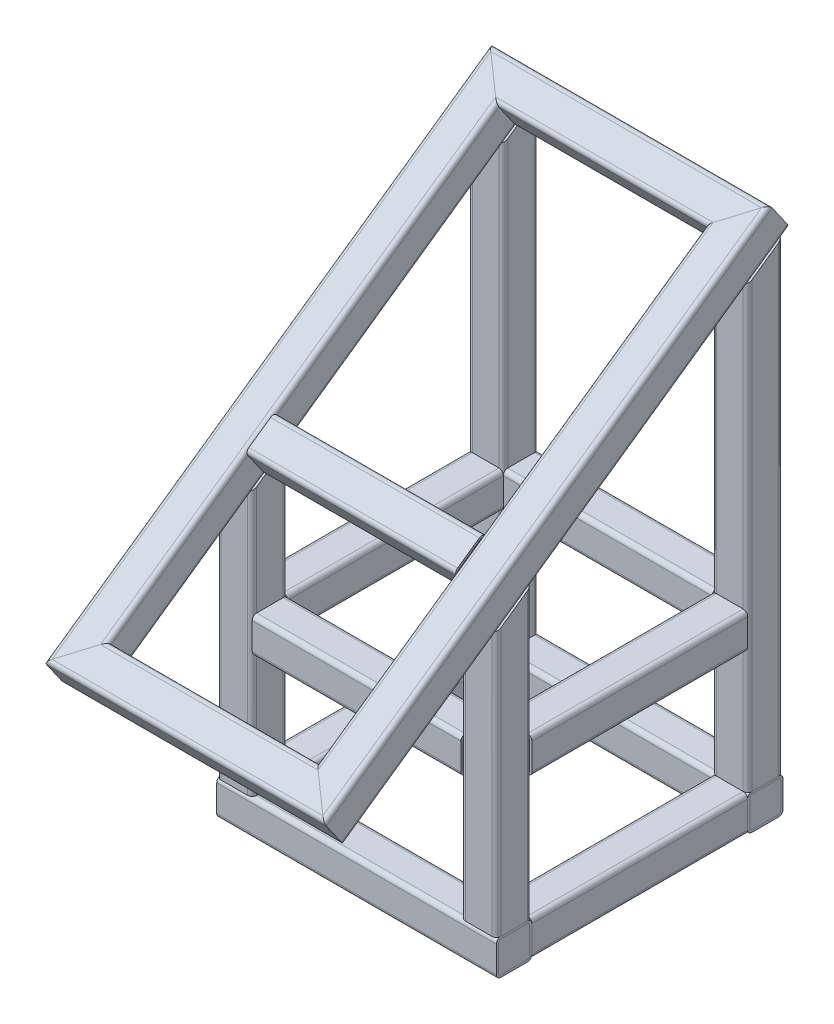
from build123d import *

# Parameters (mm, degrees)
TUBE_TUBE_101_6X101_6X6_35_1_DEPTH      = 750.8
TUBE_TUBE_101_6X101_6X6_35_1_DEPTH_BACK = 50.8
TUBE_TUBE_101_6X101_6X6_35_1_2_DEPTH    = 801.6
TUBE_TUBE_101_6X101_6X6_35_1_3_DEPTH    = 801.6
TUBE_TUBE_101_6X101_6X6_35_1_4_DEPTH    = 801.6
TUBE_TUBE_101_6X101_6X6_35_1_5_DEPTH    = 722
TUBE_TUBE_101_6X101_6X6_35_1_6_DEPTH    = 722
TUBE_TUBE_101_6X101_6X6_35_1_7_DEPTH    = 722
TUBE_TUBE_101_6X101_6X6_35_1_8_DEPTH    = 722
TUBE_TUBE_101_6X101_6X6_35_3_DEPTH      = 1410
TUBE_TUBE_101_6X101_6X6_35_3_2_DEPTH    = 905.850572489
TUBE_TUBE_101_6X101_6X6_35_3_3_DEPTH    = 1410
TUBE_TUBE_101_6X101_6X6_35_3_4_DEPTH    = 905.850572489
TUBE_TUBE_101_6X101_6X6_35_4_DEPTH      = 1509.757703908
TUBE_TUBE_101_6X101_6X6_35_4_DEPTH_BACK = 50.8
TUBE_TUBE_101_6X101_6X6_35_4_2_DEPTH    = 1560.557703908
TUBE_TUBE_101_6X101_6X6_35_4_3_DEPTH    = 702
TUBE_TUBE_101_6X101_6X6_35_4_4_DEPTH    = 702
TUBE_TUBE_101_6X101_6X6_35_4_5_DEPTH    = 702
BODY_START                              = 51.8
BODY_17_RUN_ON_DEPTH                    = 101.6
BODY_START_2                            = 650.2
BODY_17_RUN_ON_2_DEPTH                  = 101.6
BODY_16_RUN_ON_DEPTH                    = 101.6
BODY_16_RUN_ON_2_DEPTH                  = 101.6
END_START                               = -50.8
END_CAP1_DEPTH                          = 5
END_START_2                             = 745.8
END_CAP1_2_DEPTH                        = 5


# Read off the part's stored shape, not the designer's step: End cap1
with BuildPart() as part:
    # Sketch21 → Tube TUBE 101.6X101.6X6.35(1) (new, two sides: drawn at the far end of the back side and taken through both)
    with BuildSketch(Plane(origin=(0, 0, 0), x_dir=(0, 0, -1), z_dir=(1, 0, 0)).offset(-TUBE_TUBE_101_6X101_6X6_35_1_DEPTH_BACK)):
        with BuildLine():
            Line((-38.1, -50.8), (38.1, -50.8))
            ThreePointArc((38.1, -50.8), (47.080256121, -47.080256121), (50.8, -38.1))
            Line((50.8, -38.1), (50.8, 38.1))
            ThreePointArc((50.8, 38.1), (47.080256121, 47.080256121), (38.1, 50.8))
            Line((38.1, 50.8), (-38.1, 50.8))
            ThreePointArc((-38.1, 50.8), (-47.080256121, 47.080256121), (-50.8, 38.1))
            Line((-50.8, 38.1), (-50.8, -38.1))
            ThreePointArc((-50.8, -38.1), (-47.080256121, -47.080256121), (-38.1, -50.8))
        make_face()
        with BuildLine():
            Line((-44.45, -38.1), (-44.45, 38.1))
            ThreePointArc((-44.45, 38.1), (-42.590128061, 42.590128061), (-38.1, 44.45))
            Line((-38.1, 44.45), (38.1, 44.45))
            ThreePointArc((38.1, 44.45), (42.590128061, 42.590128061), (44.45, 38.1))
            Line((44.45, 38.1), (44.45, -38.1))
            ThreePointArc((44.45, -38.1), (42.590128061, -42.590128061), (38.1, -44.45))
            Line((38.1, -44.45), (-38.1, -44.45))
            ThreePointArc((-38.1, -44.45), (-42.590128061, -42.590128061), (-44.45, -38.1))
        make_face(mode=Mode.SUBTRACT)
    extrude(amount=TUBE_TUBE_101_6X101_6X6_35_1_DEPTH + TUBE_TUBE_101_6X101_6X6_35_1_DEPTH_BACK)


with BuildPart() as body_2:
    # Sketch21 on segment 2 (carried to segment 2) → Tube TUBE 101.6X101.6X6.35_1 2 (new body)
    with BuildSketch(Plane(origin=(-50.8, 0, 720), x_dir=(0, 0, -1), z_dir=(1, 0, 0))):
        with BuildLine():
            Line((-38.1, -50.8), (38.1, -50.8))
            ThreePointArc((38.1, -50.8), (47.080256121, -47.080256121), (50.8, -38.1))
            Line((50.8, -38.1), (50.8, 38.1))
            ThreePointArc((50.8, 38.1), (47.080256121, 47.080256121), (38.1, 50.8))
            Line((38.1, 50.8), (-38.1, 50.8))
            ThreePointArc((-38.1, 50.8), (-47.080256121, 47.080256121), (-50.8, 38.1))
            Line((-50.8, 38.1), (-50.8, -38.1))
            ThreePointArc((-50.8, -38.1), (-47.080256121, -47.080256121), (-38.1, -50.8))
        make_face()
        with BuildLine():
            Line((-44.45, -38.1), (-44.45, 38.1))
            ThreePointArc((-44.45, 38.1), (-42.590128061, 42.590128061), (-38.1, 44.45))
            Line((-38.1, 44.45), (38.1, 44.45))
            ThreePointArc((38.1, 44.45), (42.590128061, 42.590128061), (44.45, 38.1))
            Line((44.45, 38.1), (44.45, -38.1))
            ThreePointArc((44.45, -38.1), (42.590128061, -42.590128061), (38.1, -44.45))
            Line((38.1, -44.45), (-38.1, -44.45))
            ThreePointArc((-38.1, -44.45), (-42.590128061, -42.590128061), (-44.45, -38.1))
        make_face(mode=Mode.SUBTRACT)
    extrude(amount=TUBE_TUBE_101_6X101_6X6_35_1_2_DEPTH)


with BuildPart() as body_3:
    # Sketch21 on segment 3 (carried to segment 3) → Tube TUBE 101.6X101.6X6.35_1 3 (new body)
    with BuildSketch(Plane(origin=(-50.8, 452.93, 0), x_dir=(0, 0, -1), z_dir=(1, 0, 0))):
        with BuildLine():
            Line((-38.1, -50.8), (38.1, -50.8))
            ThreePointArc((38.1, -50.8), (47.080256121, -47.080256121), (50.8, -38.1))
            Line((50.8, -38.1), (50.8, 38.1))
            ThreePointArc((50.8, 38.1), (47.080256121, 47.080256121), (38.1, 50.8))
            Line((38.1, 50.8), (-38.1, 50.8))
            ThreePointArc((-38.1, 50.8), (-47.080256121, 47.080256121), (-50.8, 38.1))
            Line((-50.8, 38.1), (-50.8, -38.1))
            ThreePointArc((-50.8, -38.1), (-47.080256121, -47.080256121), (-38.1, -50.8))
        make_face()
        with BuildLine():
            Line((-44.45, -38.1), (-44.45, 38.1))
            ThreePointArc((-44.45, 38.1), (-42.590128061, 42.590128061), (-38.1, 44.45))
            Line((-38.1, 44.45), (38.1, 44.45))
            ThreePointArc((38.1, 44.45), (42.590128061, 42.590128061), (44.45, 38.1))
            Line((44.45, 38.1), (44.45, -38.1))
            ThreePointArc((44.45, -38.1), (42.590128061, -42.590128061), (38.1, -44.45))
            Line((38.1, -44.45), (-38.1, -44.45))
            ThreePointArc((-38.1, -44.45), (-42.590128061, -42.590128061), (-44.45, -38.1))
        make_face(mode=Mode.SUBTRACT)
    extrude(amount=TUBE_TUBE_101_6X101_6X6_35_1_3_DEPTH)

    # Trim_Extend5 43
    split(bisect_by=Plane(origin=(649.2, 0, 0), x_dir=(0, -1, 0), z_dir=(-1, 0, 0)), keep=Keep.TOP)

    # Trim_Extend5 86
    split(bisect_by=Plane.YZ.offset(50.8), keep=Keep.TOP)


with BuildPart() as body_4:
    # Sketch21 on segment 4 (carried to segment 4) → Tube TUBE 101.6X101.6X6.35_1 4 (new body)
    with BuildSketch(Plane(origin=(-50.8, 452.93, 720), x_dir=(0, 0, -1), z_dir=(1, 0, 0))):
        with BuildLine():
            Line((-38.1, -50.8), (38.1, -50.8))
            ThreePointArc((38.1, -50.8), (47.080256121, -47.080256121), (50.8, -38.1))
            Line((50.8, -38.1), (50.8, 38.1))
            ThreePointArc((50.8, 38.1), (47.080256121, 47.080256121), (38.1, 50.8))
            Line((38.1, 50.8), (-38.1, 50.8))
            ThreePointArc((-38.1, 50.8), (-47.080256121, 47.080256121), (-50.8, 38.1))
            Line((-50.8, 38.1), (-50.8, -38.1))
            ThreePointArc((-50.8, -38.1), (-47.080256121, -47.080256121), (-38.1, -50.8))
        make_face()
        with BuildLine():
            Line((-44.45, -38.1), (-44.45, 38.1))
            ThreePointArc((-44.45, 38.1), (-42.590128061, 42.590128061), (-38.1, 44.45))
            Line((-38.1, 44.45), (38.1, 44.45))
            ThreePointArc((38.1, 44.45), (42.590128061, 42.590128061), (44.45, 38.1))
            Line((44.45, 38.1), (44.45, -38.1))
            ThreePointArc((44.45, -38.1), (42.590128061, -42.590128061), (38.1, -44.45))
            Line((38.1, -44.45), (-38.1, -44.45))
            ThreePointArc((-38.1, -44.45), (-42.590128061, -42.590128061), (-44.45, -38.1))
        make_face(mode=Mode.SUBTRACT)
    extrude(amount=TUBE_TUBE_101_6X101_6X6_35_1_4_DEPTH)

    # Trim_Extend5 43
    split(bisect_by=Plane(origin=(649.2, 0, 0), x_dir=(0, -1, 0), z_dir=(-1, 0, 0)), keep=Keep.TOP)

    # Trim_Extend5 86
    split(bisect_by=Plane.YZ.offset(50.8), keep=Keep.TOP)


with BuildPart() as body_5:
    # Sketch21 on segment 5 (carried to segment 5) → Tube TUBE 101.6X101.6X6.35_1 5 (new body)
    with BuildSketch(Plane(origin=(700, 0, -1), x_dir=(1, 0, 0), z_dir=(0, 0, 1))):
        with BuildLine():
            Line((-38.1, -50.8), (38.1, -50.8))
            ThreePointArc((38.1, -50.8), (47.080256121, -47.080256121), (50.8, -38.1))
            Line((50.8, -38.1), (50.8, 38.1))
            ThreePointArc((50.8, 38.1), (47.080256121, 47.080256121), (38.1, 50.8))
            Line((38.1, 50.8), (-38.1, 50.8))
            ThreePointArc((-38.1, 50.8), (-47.080256121, 47.080256121), (-50.8, 38.1))
            Line((-50.8, 38.1), (-50.8, -38.1))
            ThreePointArc((-50.8, -38.1), (-47.080256121, -47.080256121), (-38.1, -50.8))
        make_face()
        with BuildLine():
            Line((-44.45, -38.1), (-44.45, 38.1))
            ThreePointArc((-44.45, 38.1), (-42.590128061, 42.590128061), (-38.1, 44.45))
            Line((-38.1, 44.45), (38.1, 44.45))
            ThreePointArc((38.1, 44.45), (42.590128061, 42.590128061), (44.45, 38.1))
            Line((44.45, 38.1), (44.45, -38.1))
            ThreePointArc((44.45, -38.1), (42.590128061, -42.590128061), (38.1, -44.45))
            Line((38.1, -44.45), (-38.1, -44.45))
            ThreePointArc((-38.1, -44.45), (-42.590128061, -42.590128061), (-44.45, -38.1))
        make_face(mode=Mode.SUBTRACT)
    extrude(amount=TUBE_TUBE_101_6X101_6X6_35_1_5_DEPTH)

    # Tube TUBE 101.6X101.6X6.35_1 5 end butt
    split(bisect_by=Plane(origin=(700, 0, 50.8), x_dir=(0, -1, 0), z_dir=(0, 0, 1)), keep=Keep.TOP)

    # Tube TUBE 101.6X101.6X6.35_1 5 end b 2
    split(bisect_by=Plane(origin=(700, 0, 669.2), x_dir=(0, 1, 0), z_dir=(0, 0, -1)), keep=Keep.TOP)


with BuildPart() as body_6:
    # Sketch21 on segment 6 (carried to segment 6) → Tube TUBE 101.6X101.6X6.35_1 6 (new body)
    with BuildSketch(Plane.XY.offset(-1)):
        with BuildLine():
            Line((-38.1, -50.8), (38.1, -50.8))
            ThreePointArc((38.1, -50.8), (47.080256121, -47.080256121), (50.8, -38.1))
            Line((50.8, -38.1), (50.8, 38.1))
            ThreePointArc((50.8, 38.1), (47.080256121, 47.080256121), (38.1, 50.8))
            Line((38.1, 50.8), (-38.1, 50.8))
            ThreePointArc((-38.1, 50.8), (-47.080256121, 47.080256121), (-50.8, 38.1))
            Line((-50.8, 38.1), (-50.8, -38.1))
            ThreePointArc((-50.8, -38.1), (-47.080256121, -47.080256121), (-38.1, -50.8))
        make_face()
        with BuildLine():
            Line((-44.45, -38.1), (-44.45, 38.1))
            ThreePointArc((-44.45, 38.1), (-42.590128061, 42.590128061), (-38.1, 44.45))
            Line((-38.1, 44.45), (38.1, 44.45))
            ThreePointArc((38.1, 44.45), (42.590128061, 42.590128061), (44.45, 38.1))
            Line((44.45, 38.1), (44.45, -38.1))
            ThreePointArc((44.45, -38.1), (42.590128061, -42.590128061), (38.1, -44.45))
            Line((38.1, -44.45), (-38.1, -44.45))
            ThreePointArc((-38.1, -44.45), (-42.590128061, -42.590128061), (-44.45, -38.1))
        make_face(mode=Mode.SUBTRACT)
    extrude(amount=TUBE_TUBE_101_6X101_6X6_35_1_6_DEPTH)

    # Tube TUBE 101.6X101.6X6.35_1 6 end butt
    split(bisect_by=Plane(origin=(0, 0, 50.8), x_dir=(0, -1, 0), z_dir=(0, 0, 1)), keep=Keep.TOP)

    # Tube TUBE 101.6X101.6X6.35_1 6 end b 2
    split(bisect_by=Plane.YX.offset(-669.2), keep=Keep.TOP)


with BuildPart() as body_7:
    # Sketch21 on segment 7 (carried to segment 7) → Tube TUBE 101.6X101.6X6.35_1 7 (new body)
    with BuildSketch(Plane(origin=(700, 452.93, 721), x_dir=(-1, 0, 0), z_dir=(0, 0, -1))):
        with BuildLine():
            Line((-38.1, -50.8), (38.1, -50.8))
            ThreePointArc((38.1, -50.8), (47.080256121, -47.080256121), (50.8, -38.1))
            Line((50.8, -38.1), (50.8, 38.1))
            ThreePointArc((50.8, 38.1), (47.080256121, 47.080256121), (38.1, 50.8))
            Line((38.1, 50.8), (-38.1, 50.8))
            ThreePointArc((-38.1, 50.8), (-47.080256121, 47.080256121), (-50.8, 38.1))
            Line((-50.8, 38.1), (-50.8, -38.1))
            ThreePointArc((-50.8, -38.1), (-47.080256121, -47.080256121), (-38.1, -50.8))
        make_face()
        with BuildLine():
            Line((-44.45, -38.1), (-44.45, 38.1))
            ThreePointArc((-44.45, 38.1), (-42.590128061, 42.590128061), (-38.1, 44.45))
            Line((-38.1, 44.45), (38.1, 44.45))
            ThreePointArc((38.1, 44.45), (42.590128061, 42.590128061), (44.45, 38.1))
            Line((44.45, 38.1), (44.45, -38.1))
            ThreePointArc((44.45, -38.1), (42.590128061, -42.590128061), (38.1, -44.45))
            Line((38.1, -44.45), (-38.1, -44.45))
            ThreePointArc((-38.1, -44.45), (-42.590128061, -42.590128061), (-44.45, -38.1))
        make_face(mode=Mode.SUBTRACT)
    extrude(amount=TUBE_TUBE_101_6X101_6X6_35_1_7_DEPTH)

    # Tube TUBE 101.6X101.6X6.35_1 7 end butt
    split(bisect_by=Plane(origin=(700, 452.93, 669.2), x_dir=(0, 1, 0), z_dir=(0, 0, -1)), keep=Keep.TOP)

    # Tube TUBE 101.6X101.6X6.35_1 7 end b 2
    split(bisect_by=Plane(origin=(700, 452.93, 50.8), x_dir=(0, -1, 0), z_dir=(0, 0, 1)), keep=Keep.TOP)


with BuildPart() as body_8:
    # Sketch21 on segment 8 (carried to segment 8) → Tube TUBE 101.6X101.6X6.35_1 8 (new body)
    with BuildSketch(Plane(origin=(0, 452.93, 721), x_dir=(-1, 0, 0), z_dir=(0, 0, -1))):
        with BuildLine():
            Line((-38.1, -50.8), (38.1, -50.8))
            ThreePointArc((38.1, -50.8), (47.080256121, -47.080256121), (50.8, -38.1))
            Line((50.8, -38.1), (50.8, 38.1))
            ThreePointArc((50.8, 38.1), (47.080256121, 47.080256121), (38.1, 50.8))
            Line((38.1, 50.8), (-38.1, 50.8))
            ThreePointArc((-38.1, 50.8), (-47.080256121, 47.080256121), (-50.8, 38.1))
            Line((-50.8, 38.1), (-50.8, -38.1))
            ThreePointArc((-50.8, -38.1), (-47.080256121, -47.080256121), (-38.1, -50.8))
        make_face()
        with BuildLine():
            Line((-44.45, -38.1), (-44.45, 38.1))
            ThreePointArc((-44.45, 38.1), (-42.590128061, 42.590128061), (-38.1, 44.45))
            Line((-38.1, 44.45), (38.1, 44.45))
            ThreePointArc((38.1, 44.45), (42.590128061, 42.590128061), (44.45, 38.1))
            Line((44.45, 38.1), (44.45, -38.1))
            ThreePointArc((44.45, -38.1), (42.590128061, -42.590128061), (38.1, -44.45))
            Line((38.1, -44.45), (-38.1, -44.45))
            ThreePointArc((-38.1, -44.45), (-42.590128061, -42.590128061), (-44.45, -38.1))
        make_face(mode=Mode.SUBTRACT)
    extrude(amount=TUBE_TUBE_101_6X101_6X6_35_1_8_DEPTH)

    # Tube TUBE 101.6X101.6X6.35_1 8 end butt
    split(bisect_by=Plane(origin=(0, 452.93, 669.2), x_dir=(0, 1, 0), z_dir=(0, 0, -1)), keep=Keep.TOP)

    # Tube TUBE 101.6X101.6X6.35_1 8 end b 2
    split(bisect_by=Plane(origin=(0, 452.93, 50.8), x_dir=(0, -1, 0), z_dir=(0, 0, 1)), keep=Keep.TOP)


with BuildPart() as body_9:
    # Sketch22 → Tube TUBE 101.6X101.6X6.35(3) (new body)
    with BuildSketch(Plane(origin=(700, 0, 0), x_dir=(0, 0, 1), z_dir=(0, 1, 0))):
        with BuildLine():
            Line((-38.1, -50.8), (38.1, -50.8))
            ThreePointArc((38.1, -50.8), (47.080256121, -47.080256121), (50.8, -38.1))
            Line((50.8, -38.1), (50.8, 38.1))
            ThreePointArc((50.8, 38.1), (47.080256121, 47.080256121), (38.1, 50.8))
            Line((38.1, 50.8), (-38.1, 50.8))
            ThreePointArc((-38.1, 50.8), (-47.080256121, 47.080256121), (-50.8, 38.1))
            Line((-50.8, 38.1), (-50.8, -38.1))
            ThreePointArc((-50.8, -38.1), (-47.080256121, -47.080256121), (-38.1, -50.8))
        make_face()
        with BuildLine():
            Line((-44.45, -38.1), (-44.45, 38.1))
            ThreePointArc((-44.45, 38.1), (-42.590128061, 42.590128061), (-38.1, 44.45))
            Line((-38.1, 44.45), (38.1, 44.45))
            ThreePointArc((38.1, 44.45), (42.590128061, 42.590128061), (44.45, 38.1))
            Line((44.45, 38.1), (44.45, -38.1))
            ThreePointArc((44.45, -38.1), (42.590128061, -42.590128061), (38.1, -44.45))
            Line((38.1, -44.45), (-38.1, -44.45))
            ThreePointArc((-38.1, -44.45), (-42.590128061, -42.590128061), (-44.45, -38.1))
        make_face(mode=Mode.SUBTRACT)
    extrude(amount=TUBE_TUBE_101_6X101_6X6_35_3_DEPTH)

    # Trim/Extend6
    split(bisect_by=Plane(origin=(700.663309154, 949.97519595, 568.416409905), x_dir=(1, 0, 0), z_dir=(0, -0.819152044, -0.573576436)), keep=Keep.TOP)

    # Trim/Extend7
    split(bisect_by=Plane(origin=(700, 50.8, 360), x_dir=(-1, 0, 0), z_dir=(0, 1, 0)), keep=Keep.TOP)


with BuildPart() as body_10:
    # Sketch22 on segment 2 (carried to segment 2) → Tube TUBE 101.6X101.6X6.35_3 2 (new body)
    with BuildSketch(Plane(origin=(700, 0, 720), x_dir=(0, 0, 1), z_dir=(0, 1, 0))):
        with BuildLine():
            Line((-38.1, -50.8), (38.1, -50.8))
            ThreePointArc((38.1, -50.8), (47.080256121, -47.080256121), (50.8, -38.1))
            Line((50.8, -38.1), (50.8, 38.1))
            ThreePointArc((50.8, 38.1), (47.080256121, 47.080256121), (38.1, 50.8))
            Line((38.1, 50.8), (-38.1, 50.8))
            ThreePointArc((-38.1, 50.8), (-47.080256121, 47.080256121), (-50.8, 38.1))
            Line((-50.8, 38.1), (-50.8, -38.1))
            ThreePointArc((-50.8, -38.1), (-47.080256121, -47.080256121), (-38.1, -50.8))
        make_face()
        with BuildLine():
            Line((-44.45, -38.1), (-44.45, 38.1))
            ThreePointArc((-44.45, 38.1), (-42.590128061, 42.590128061), (-38.1, 44.45))
            Line((-38.1, 44.45), (38.1, 44.45))
            ThreePointArc((38.1, 44.45), (42.590128061, 42.590128061), (44.45, 38.1))
            Line((44.45, 38.1), (44.45, -38.1))
            ThreePointArc((44.45, -38.1), (42.590128061, -42.590128061), (38.1, -44.45))
            Line((38.1, -44.45), (-38.1, -44.45))
            ThreePointArc((-38.1, -44.45), (-42.590128061, -42.590128061), (-44.45, -38.1))
        make_face(mode=Mode.SUBTRACT)
    extrude(amount=TUBE_TUBE_101_6X101_6X6_35_3_2_DEPTH)

    # Trim/Extend6
    split(bisect_by=Plane(origin=(700.663309154, 949.97519595, 568.416409905), x_dir=(1, 0, 0), z_dir=(0, -0.819152044, -0.573576436)), keep=Keep.TOP)

    # Trim/Extend7
    split(bisect_by=Plane(origin=(700, 50.8, 360), x_dir=(-1, 0, 0), z_dir=(0, 1, 0)), keep=Keep.TOP)


with BuildPart() as body_11:
    # Sketch22 on segment 3 (carried to segment 3) → Tube TUBE 101.6X101.6X6.35_3 3 (new body)
    with BuildSketch(Plane.ZX):
        with BuildLine():
            Line((-38.1, -50.8), (38.1, -50.8))
            ThreePointArc((38.1, -50.8), (47.080256121, -47.080256121), (50.8, -38.1))
            Line((50.8, -38.1), (50.8, 38.1))
            ThreePointArc((50.8, 38.1), (47.080256121, 47.080256121), (38.1, 50.8))
            Line((38.1, 50.8), (-38.1, 50.8))
            ThreePointArc((-38.1, 50.8), (-47.080256121, 47.080256121), (-50.8, 38.1))
            Line((-50.8, 38.1), (-50.8, -38.1))
            ThreePointArc((-50.8, -38.1), (-47.080256121, -47.080256121), (-38.1, -50.8))
        make_face()
        with BuildLine():
            Line((-44.45, -38.1), (-44.45, 38.1))
            ThreePointArc((-44.45, 38.1), (-42.590128061, 42.590128061), (-38.1, 44.45))
            Line((-38.1, 44.45), (38.1, 44.45))
            ThreePointArc((38.1, 44.45), (42.590128061, 42.590128061), (44.45, 38.1))
            Line((44.45, 38.1), (44.45, -38.1))
            ThreePointArc((44.45, -38.1), (42.590128061, -42.590128061), (38.1, -44.45))
            Line((38.1, -44.45), (-38.1, -44.45))
            ThreePointArc((-38.1, -44.45), (-42.590128061, -42.590128061), (-44.45, -38.1))
        make_face(mode=Mode.SUBTRACT)
    extrude(amount=TUBE_TUBE_101_6X101_6X6_35_3_3_DEPTH)

    # Trim/Extend6
    split(bisect_by=Plane(origin=(700.663309154, 949.97519595, 568.416409905), x_dir=(1, 0, 0), z_dir=(0, -0.819152044, -0.573576436)), keep=Keep.TOP)

    # Trim/Extend7
    split(bisect_by=Plane(origin=(700, 50.8, 360), x_dir=(-1, 0, 0), z_dir=(0, 1, 0)), keep=Keep.TOP)


with BuildPart() as body_12:
    # Sketch22 on segment 4 (carried to segment 4) → Tube TUBE 101.6X101.6X6.35_3 4 (new body)
    with BuildSketch(Plane(origin=(0, 0, 720), x_dir=(0, 0, 1), z_dir=(0, 1, 0))):
        with BuildLine():
            Line((-38.1, -50.8), (38.1, -50.8))
            ThreePointArc((38.1, -50.8), (47.080256121, -47.080256121), (50.8, -38.1))
            Line((50.8, -38.1), (50.8, 38.1))
            ThreePointArc((50.8, 38.1), (47.080256121, 47.080256121), (38.1, 50.8))
            Line((38.1, 50.8), (-38.1, 50.8))
            ThreePointArc((-38.1, 50.8), (-47.080256121, 47.080256121), (-50.8, 38.1))
            Line((-50.8, 38.1), (-50.8, -38.1))
            ThreePointArc((-50.8, -38.1), (-47.080256121, -47.080256121), (-38.1, -50.8))
        make_face()
        with BuildLine():
            Line((-44.45, -38.1), (-44.45, 38.1))
            ThreePointArc((-44.45, 38.1), (-42.590128061, 42.590128061), (-38.1, 44.45))
            Line((-38.1, 44.45), (38.1, 44.45))
            ThreePointArc((38.1, 44.45), (42.590128061, 42.590128061), (44.45, 38.1))
            Line((44.45, 38.1), (44.45, -38.1))
            ThreePointArc((44.45, -38.1), (42.590128061, -42.590128061), (38.1, -44.45))
            Line((38.1, -44.45), (-38.1, -44.45))
            ThreePointArc((-38.1, -44.45), (-42.590128061, -42.590128061), (-44.45, -38.1))
        make_face(mode=Mode.SUBTRACT)
    extrude(amount=TUBE_TUBE_101_6X101_6X6_35_3_4_DEPTH)

    # Trim/Extend6
    split(bisect_by=Plane(origin=(700.663309154, 949.97519595, 568.416409905), x_dir=(1, 0, 0), z_dir=(0, -0.819152044, -0.573576436)), keep=Keep.TOP)

    # Trim/Extend7
    split(bisect_by=Plane(origin=(700, 50.8, 360), x_dir=(-1, 0, 0), z_dir=(0, 1, 0)), keep=Keep.TOP)


with BuildPart() as body_13:
    # Sketch23 → Tube TUBE 101.6X101.6X6.35(4) (new, two sides: drawn at the far end of the back side and taken through both)
    with BuildSketch(Plane(origin=(0, 1410, 0), x_dir=(0, -0.8191520442889891, -0.5735764363510498), z_dir=(0, -0.5735764363510499, 0.8191520442889892)).offset(-TUBE_TUBE_101_6X101_6X6_35_4_DEPTH_BACK)):
        with BuildLine():
            Line((-38.1, -50.8), (38.1, -50.8))
            ThreePointArc((38.1, -50.8), (47.080256121, -47.080256121), (50.8, -38.1))
            Line((50.8, -38.1), (50.8, 38.1))
            ThreePointArc((50.8, 38.1), (47.080256121, 47.080256121), (38.1, 50.8))
            Line((38.1, 50.8), (-38.1, 50.8))
            ThreePointArc((-38.1, 50.8), (-47.080256121, 47.080256121), (-50.8, 38.1))
            Line((-50.8, 38.1), (-50.8, -38.1))
            ThreePointArc((-50.8, -38.1), (-47.080256121, -47.080256121), (-38.1, -50.8))
        make_face()
        with BuildLine():
            Line((-44.45, -38.1), (-44.45, 38.1))
            ThreePointArc((-44.45, 38.1), (-42.590128061, 42.590128061), (-38.1, 44.45))
            Line((-38.1, 44.45), (38.1, 44.45))
            ThreePointArc((38.1, 44.45), (42.590128061, 42.590128061), (44.45, 38.1))
            Line((44.45, 38.1), (44.45, -38.1))
            ThreePointArc((44.45, -38.1), (42.590128061, -42.590128061), (38.1, -44.45))
            Line((38.1, -44.45), (-38.1, -44.45))
            ThreePointArc((-38.1, -44.45), (-42.590128061, -42.590128061), (-44.45, -38.1))
        make_face(mode=Mode.SUBTRACT)
    extrude(amount=TUBE_TUBE_101_6X101_6X6_35_4_DEPTH + TUBE_TUBE_101_6X101_6X6_35_4_DEPTH_BACK)

    # Trim/Extend1
    split(bisect_by=Plane(origin=(0, 1410, 0), x_dir=(0.497542812, -0.867439422, 0), z_dir=(-0.707106781, -0.405579788, 0.579227965)), keep=Keep.TOP)

    # Trim/Extend3
    split(bisect_by=Plane(origin=(0, 573.176239405, 1195.108185688), x_dir=(-0.497542812, -0.867439422, 0), z_dir=(-0.707106781, 0.405579788, -0.579227965)), keep=Keep.TOP)


with BuildPart() as body_14:
    # Sketch23 on segment 2 (carried to segment 2) → Tube TUBE 101.6X101.6X6.35_4 2 (new body)
    with BuildSketch(Plane(origin=(700, 1439.137682967, -41.61292385), x_dir=(0, -0.819152044, -0.573576436), z_dir=(0, -0.573576436, 0.819152044))):
        with BuildLine():
            Line((-38.1, -50.8), (38.1, -50.8))
            ThreePointArc((38.1, -50.8), (47.080256121, -47.080256121), (50.8, -38.1))
            Line((50.8, -38.1), (50.8, 38.1))
            ThreePointArc((50.8, 38.1), (47.080256121, 47.080256121), (38.1, 50.8))
            Line((38.1, 50.8), (-38.1, 50.8))
            ThreePointArc((-38.1, 50.8), (-47.080256121, 47.080256121), (-50.8, 38.1))
            Line((-50.8, 38.1), (-50.8, -38.1))
            ThreePointArc((-50.8, -38.1), (-47.080256121, -47.080256121), (-38.1, -50.8))
        make_face()
        with BuildLine():
            Line((-44.45, -38.1), (-44.45, 38.1))
            ThreePointArc((-44.45, 38.1), (-42.590128061, 42.590128061), (-38.1, 44.45))
            Line((-38.1, 44.45), (38.1, 44.45))
            ThreePointArc((38.1, 44.45), (42.590128061, 42.590128061), (44.45, 38.1))
            Line((44.45, 38.1), (44.45, -38.1))
            ThreePointArc((44.45, -38.1), (42.590128061, -42.590128061), (38.1, -44.45))
            Line((38.1, -44.45), (-38.1, -44.45))
            ThreePointArc((-38.1, -44.45), (-42.590128061, -42.590128061), (-44.45, -38.1))
        make_face(mode=Mode.SUBTRACT)
    extrude(amount=TUBE_TUBE_101_6X101_6X6_35_4_2_DEPTH)

    # Trim/Extend2
    split(bisect_by=Plane(origin=(700, 1410, 0), x_dir=(0.497542812, 0.867439422, 0), z_dir=(0.707106781, -0.405579788, 0.579227965)), keep=Keep.TOP)

    # Trim/Extend4
    split(bisect_by=Plane(origin=(700, 573.176239405, 1195.108185688), x_dir=(-0.497542812, 0.867439422, 0), z_dir=(0.707106781, 0.405579788, -0.579227965)), keep=Keep.TOP)


with BuildPart() as body_15:
    # Sketch23 on segment 3 (carried to segment 3) → Tube TUBE 101.6X101.6X6.35_4 3 (new body)
    with BuildSketch(Plane(origin=(-1, 905.850572489, 720), x_dir=(0, -0.819152044, -0.573576436), z_dir=(1, 0, 0))):
        with BuildLine():
            Line((-38.1, -50.8), (38.1, -50.8))
            ThreePointArc((38.1, -50.8), (47.080256121, -47.080256121), (50.8, -38.1))
            Line((50.8, -38.1), (50.8, 38.1))
            ThreePointArc((50.8, 38.1), (47.080256121, 47.080256121), (38.1, 50.8))
            Line((38.1, 50.8), (-38.1, 50.8))
            ThreePointArc((-38.1, 50.8), (-47.080256121, 47.080256121), (-50.8, 38.1))
            Line((-50.8, 38.1), (-50.8, -38.1))
            ThreePointArc((-50.8, -38.1), (-47.080256121, -47.080256121), (-38.1, -50.8))
        make_face()
        with BuildLine():
            Line((-44.45, -38.1), (-44.45, 38.1))
            ThreePointArc((-44.45, 38.1), (-42.590128061, 42.590128061), (-38.1, 44.45))
            Line((-38.1, 44.45), (38.1, 44.45))
            ThreePointArc((38.1, 44.45), (42.590128061, 42.590128061), (44.45, 38.1))
            Line((44.45, 38.1), (44.45, -38.1))
            ThreePointArc((44.45, -38.1), (42.590128061, -42.590128061), (38.1, -44.45))
            Line((38.1, -44.45), (-38.1, -44.45))
            ThreePointArc((-38.1, -44.45), (-42.590128061, -42.590128061), (-44.45, -38.1))
        make_face(mode=Mode.SUBTRACT)
    extrude(amount=TUBE_TUBE_101_6X101_6X6_35_4_3_DEPTH)

    # Tube TUBE 101.6X101.6X6.35_4 3 end butt
    split(bisect_by=Plane(origin=(50.8, 905.850572489, 720), x_dir=(0, 1, 0), z_dir=(1, 0, 0)), keep=Keep.TOP)

    # Tube TUBE 101.6X101.6X6.35_4 3 end b 2
    split(bisect_by=Plane(origin=(649.2, 905.850572489, 720), x_dir=(0, -1, 0), z_dir=(-1, 0, 0)), keep=Keep.TOP)


with BuildPart() as body_16:
    # Sketch23 on segment 4 (carried to segment 4) → Tube TUBE 101.6X101.6X6.35_4 4 (new body)
    with BuildSketch(Plane(origin=(-1, 573.176239405, 1195.108185688), x_dir=(0, -0.819152044, -0.573576436), z_dir=(1, 0, 0))):
        with BuildLine():
            Line((-38.1, -50.8), (38.1, -50.8))
            ThreePointArc((38.1, -50.8), (47.080256121, -47.080256121), (50.8, -38.1))
            Line((50.8, -38.1), (50.8, 38.1))
            ThreePointArc((50.8, 38.1), (47.080256121, 47.080256121), (38.1, 50.8))
            Line((38.1, 50.8), (-38.1, 50.8))
            ThreePointArc((-38.1, 50.8), (-47.080256121, 47.080256121), (-50.8, 38.1))
            Line((-50.8, 38.1), (-50.8, -38.1))
            ThreePointArc((-50.8, -38.1), (-47.080256121, -47.080256121), (-38.1, -50.8))
        make_face()
        with BuildLine():
            Line((-44.45, -38.1), (-44.45, 38.1))
            ThreePointArc((-44.45, 38.1), (-42.590128061, 42.590128061), (-38.1, 44.45))
            Line((-38.1, 44.45), (38.1, 44.45))
            ThreePointArc((38.1, 44.45), (42.590128061, 42.590128061), (44.45, 38.1))
            Line((44.45, 38.1), (44.45, -38.1))
            ThreePointArc((44.45, -38.1), (42.590128061, -42.590128061), (38.1, -44.45))
            Line((38.1, -44.45), (-38.1, -44.45))
            ThreePointArc((-38.1, -44.45), (-42.590128061, -42.590128061), (-44.45, -38.1))
        make_face(mode=Mode.SUBTRACT)
    extrude(amount=TUBE_TUBE_101_6X101_6X6_35_4_4_DEPTH)

    # Tube TUBE 101.6X101.6X6.35_4 4 end butt
    split(bisect_by=Plane(origin=(50.8, 573.176239405, 1195.108185688), x_dir=(0, 1, 0), z_dir=(1, 0, 0)), keep=Keep.TOP)

    # Tube TUBE 101.6X101.6X6.35_4 4 end b 2
    split(bisect_by=Plane(origin=(649.2, 573.176239405, 1195.108185688), x_dir=(0, -1, 0), z_dir=(-1, 0, 0)), keep=Keep.TOP)

    # Sketch23 on segment 4 (carried to segment 4) → body 16 run on (add)
    with BuildSketch(Plane(origin=(-1, 573.176239405, 1195.108185688), x_dir=(0, -0.819152044, -0.573576436), z_dir=(1, 0, 0)).offset(BODY_START)):
        with BuildLine():
            Line((-38.1, -50.8), (38.1, -50.8))
            ThreePointArc((38.1, -50.8), (47.080256121, -47.080256121), (50.8, -38.1))
            Line((50.8, -38.1), (50.8, 38.1))
            ThreePointArc((50.8, 38.1), (47.080256121, 47.080256121), (38.1, 50.8))
            Line((38.1, 50.8), (-38.1, 50.8))
            ThreePointArc((-38.1, 50.8), (-47.080256121, 47.080256121), (-50.8, 38.1))
            Line((-50.8, 38.1), (-50.8, -38.1))
            ThreePointArc((-50.8, -38.1), (-47.080256121, -47.080256121), (-38.1, -50.8))
        make_face()
        with BuildLine():
            Line((-44.45, -38.1), (-44.45, 38.1))
            ThreePointArc((-44.45, 38.1), (-42.590128061, 42.590128061), (-38.1, 44.45))
            Line((-38.1, 44.45), (38.1, 44.45))
            ThreePointArc((38.1, 44.45), (42.590128061, 42.590128061), (44.45, 38.1))
            Line((44.45, 38.1), (44.45, -38.1))
            ThreePointArc((44.45, -38.1), (42.590128061, -42.590128061), (38.1, -44.45))
            Line((38.1, -44.45), (-38.1, -44.45))
            ThreePointArc((-38.1, -44.45), (-42.590128061, -42.590128061), (-44.45, -38.1))
        make_face(mode=Mode.SUBTRACT)
    extrude(amount=-BODY_16_RUN_ON_DEPTH)

    # Trim/Extend3
    split(bisect_by=Plane(origin=(0, 573.176239405, 1195.108185688), x_dir=(0.497542812, 0.867439422, 0), z_dir=(0.707106781, -0.405579788, 0.579227965)), keep=Keep.TOP)

    # Sketch23 on segment 4 (carried to segment 4) → body 16 run on 2 (add)
    with BuildSketch(Plane(origin=(-1, 573.176239405, 1195.108185688), x_dir=(0, -0.819152044, -0.573576436), z_dir=(1, 0, 0)).offset(BODY_START_2)):
        with BuildLine():
            Line((-38.1, -50.8), (38.1, -50.8))
            ThreePointArc((38.1, -50.8), (47.080256121, -47.080256121), (50.8, -38.1))
            Line((50.8, -38.1), (50.8, 38.1))
            ThreePointArc((50.8, 38.1), (47.080256121, 47.080256121), (38.1, 50.8))
            Line((38.1, 50.8), (-38.1, 50.8))
            ThreePointArc((-38.1, 50.8), (-47.080256121, 47.080256121), (-50.8, 38.1))
            Line((-50.8, 38.1), (-50.8, -38.1))
            ThreePointArc((-50.8, -38.1), (-47.080256121, -47.080256121), (-38.1, -50.8))
        make_face()
        with BuildLine():
            Line((-44.45, -38.1), (-44.45, 38.1))
            ThreePointArc((-44.45, 38.1), (-42.590128061, 42.590128061), (-38.1, 44.45))
            Line((-38.1, 44.45), (38.1, 44.45))
            ThreePointArc((38.1, 44.45), (42.590128061, 42.590128061), (44.45, 38.1))
            Line((44.45, 38.1), (44.45, -38.1))
            ThreePointArc((44.45, -38.1), (42.590128061, -42.590128061), (38.1, -44.45))
            Line((38.1, -44.45), (-38.1, -44.45))
            ThreePointArc((-38.1, -44.45), (-42.590128061, -42.590128061), (-44.45, -38.1))
        make_face(mode=Mode.SUBTRACT)
    extrude(amount=BODY_16_RUN_ON_2_DEPTH)

    # Trim/Extend4
    split(bisect_by=Plane(origin=(700, 573.176239405, 1195.108185688), x_dir=(0.497542812, -0.867439422, 0), z_dir=(-0.707106781, -0.405579788, 0.579227965)), keep=Keep.TOP)


with BuildPart() as body_17:
    # Sketch23 on segment 5 (carried to segment 5) → Tube TUBE 101.6X101.6X6.35_4 5 (new body)
    with BuildSketch(Plane(origin=(-1, 1410, 0), x_dir=(0, -0.819152044, -0.573576436), z_dir=(1, 0, 0))):
        with BuildLine():
            Line((-38.1, -50.8), (38.1, -50.8))
            ThreePointArc((38.1, -50.8), (47.080256121, -47.080256121), (50.8, -38.1))
            Line((50.8, -38.1), (50.8, 38.1))
            ThreePointArc((50.8, 38.1), (47.080256121, 47.080256121), (38.1, 50.8))
            Line((38.1, 50.8), (-38.1, 50.8))
            ThreePointArc((-38.1, 50.8), (-47.080256121, 47.080256121), (-50.8, 38.1))
            Line((-50.8, 38.1), (-50.8, -38.1))
            ThreePointArc((-50.8, -38.1), (-47.080256121, -47.080256121), (-38.1, -50.8))
        make_face()
        with BuildLine():
            Line((-44.45, -38.1), (-44.45, 38.1))
            ThreePointArc((-44.45, 38.1), (-42.590128061, 42.590128061), (-38.1, 44.45))
            Line((-38.1, 44.45), (38.1, 44.45))
            ThreePointArc((38.1, 44.45), (42.590128061, 42.590128061), (44.45, 38.1))
            Line((44.45, 38.1), (44.45, -38.1))
            ThreePointArc((44.45, -38.1), (42.590128061, -42.590128061), (38.1, -44.45))
            Line((38.1, -44.45), (-38.1, -44.45))
            ThreePointArc((-38.1, -44.45), (-42.590128061, -42.590128061), (-44.45, -38.1))
        make_face(mode=Mode.SUBTRACT)
    extrude(amount=TUBE_TUBE_101_6X101_6X6_35_4_5_DEPTH)

    # Tube TUBE 101.6X101.6X6.35_4 5 end butt
    split(bisect_by=Plane(origin=(50.8, 1410, 0), x_dir=(0, 1, 0), z_dir=(1, 0, 0)), keep=Keep.TOP)

    # Tube TUBE 101.6X101.6X6.35_4 5 end b 2
    split(bisect_by=Plane(origin=(649.2, 1410, 0), x_dir=(0, -1, 0), z_dir=(-1, 0, 0)), keep=Keep.TOP)

    # Sketch23 on segment 5 (carried to segment 5) → body 17 run on (add)
    with BuildSketch(Plane(origin=(-1, 1410, 0), x_dir=(0, -0.819152044, -0.573576436), z_dir=(1, 0, 0)).offset(BODY_START)):
        with BuildLine():
            Line((-38.1, -50.8), (38.1, -50.8))
            ThreePointArc((38.1, -50.8), (47.080256121, -47.080256121), (50.8, -38.1))
            Line((50.8, -38.1), (50.8, 38.1))
            ThreePointArc((50.8, 38.1), (47.080256121, 47.080256121), (38.1, 50.8))
            Line((38.1, 50.8), (-38.1, 50.8))
            ThreePointArc((-38.1, 50.8), (-47.080256121, 47.080256121), (-50.8, 38.1))
            Line((-50.8, 38.1), (-50.8, -38.1))
            ThreePointArc((-50.8, -38.1), (-47.080256121, -47.080256121), (-38.1, -50.8))
        make_face()
        with BuildLine():
            Line((-44.45, -38.1), (-44.45, 38.1))
            ThreePointArc((-44.45, 38.1), (-42.590128061, 42.590128061), (-38.1, 44.45))
            Line((-38.1, 44.45), (38.1, 44.45))
            ThreePointArc((38.1, 44.45), (42.590128061, 42.590128061), (44.45, 38.1))
            Line((44.45, 38.1), (44.45, -38.1))
            ThreePointArc((44.45, -38.1), (42.590128061, -42.590128061), (38.1, -44.45))
            Line((38.1, -44.45), (-38.1, -44.45))
            ThreePointArc((-38.1, -44.45), (-42.590128061, -42.590128061), (-44.45, -38.1))
        make_face(mode=Mode.SUBTRACT)
    extrude(amount=-BODY_17_RUN_ON_DEPTH)

    # Trim/Extend1
    split(bisect_by=Plane(origin=(0, 1410, 0), x_dir=(-0.497542812, 0.867439422, 0), z_dir=(0.707106781, 0.405579788, -0.579227965)), keep=Keep.TOP)

    # Sketch23 on segment 5 (carried to segment 5) → body 17 run on 2 (add)
    with BuildSketch(Plane(origin=(-1, 1410, 0), x_dir=(0, -0.819152044, -0.573576436), z_dir=(1, 0, 0)).offset(BODY_START_2)):
        with BuildLine():
            Line((-38.1, -50.8), (38.1, -50.8))
            ThreePointArc((38.1, -50.8), (47.080256121, -47.080256121), (50.8, -38.1))
            Line((50.8, -38.1), (50.8, 38.1))
            ThreePointArc((50.8, 38.1), (47.080256121, 47.080256121), (38.1, 50.8))
            Line((38.1, 50.8), (-38.1, 50.8))
            ThreePointArc((-38.1, 50.8), (-47.080256121, 47.080256121), (-50.8, 38.1))
            Line((-50.8, 38.1), (-50.8, -38.1))
            ThreePointArc((-50.8, -38.1), (-47.080256121, -47.080256121), (-38.1, -50.8))
        make_face()
        with BuildLine():
            Line((-44.45, -38.1), (-44.45, 38.1))
            ThreePointArc((-44.45, 38.1), (-42.590128061, 42.590128061), (-38.1, 44.45))
            Line((-38.1, 44.45), (38.1, 44.45))
            ThreePointArc((38.1, 44.45), (42.590128061, 42.590128061), (44.45, 38.1))
            Line((44.45, 38.1), (44.45, -38.1))
            ThreePointArc((44.45, -38.1), (42.590128061, -42.590128061), (38.1, -44.45))
            Line((38.1, -44.45), (-38.1, -44.45))
            ThreePointArc((-38.1, -44.45), (-42.590128061, -42.590128061), (-44.45, -38.1))
        make_face(mode=Mode.SUBTRACT)
    extrude(amount=BODY_17_RUN_ON_2_DEPTH)

    # Trim/Extend2
    split(bisect_by=Plane(origin=(700, 1410, 0), x_dir=(-0.497542812, -0.867439422, 0), z_dir=(-0.707106781, 0.405579788, -0.579227965)), keep=Keep.TOP)


with BuildPart() as body_18:
    # End cap1 outline → End cap1 (new body)
    with BuildSketch(Plane.YZ.offset(END_START)):
        with BuildLine():
            Line((-38.1, -44.45), (38.1, -44.45))
            ThreePointArc((38.1, -44.45), (42.590128061, -42.590128061), (44.45, -38.1))
            Line((44.45, -38.1), (44.45, 38.1))
            ThreePointArc((44.45, 38.1), (42.590128061, 42.590128061), (38.1, 44.45))
            Line((38.1, 44.45), (-38.1, 44.45))
            ThreePointArc((-38.1, 44.45), (-42.590128061, 42.590128061), (-44.45, 38.1))
            Line((-44.45, 38.1), (-44.45, -38.1))
            ThreePointArc((-44.45, -38.1), (-42.590128061, -42.590128061), (-38.1, -44.45))
        make_face()
        with BuildLine():
            Line((44.45, 681.9), (44.45, 758.1))
            ThreePointArc((44.45, 758.1), (42.590128061, 762.590128061), (38.1, 764.45))
            Line((38.1, 764.45), (-38.1, 764.45))
            ThreePointArc((-38.1, 764.45), (-42.590128061, 762.590128061), (-44.45, 758.1))
            Line((-44.45, 758.1), (-44.45, 681.9))
            ThreePointArc((-44.45, 681.9), (-42.590128061, 677.409871939), (-38.1, 675.55))
            Line((-38.1, 675.55), (38.1, 675.55))
            ThreePointArc((38.1, 675.55), (42.590128061, 677.409871939), (44.45, 681.9))
        make_face()
    extrude(amount=END_CAP1_DEPTH)


with BuildPart() as body_19:
    # End cap1 2 outline → End cap1 2 (new body)
    with BuildSketch(Plane.YZ.offset(END_START_2)):
        with BuildLine():
            Line((-38.1, -44.45), (38.1, -44.45))
            ThreePointArc((38.1, -44.45), (42.590128061, -42.590128061), (44.45, -38.1))
            Line((44.45, -38.1), (44.45, 38.1))
            ThreePointArc((44.45, 38.1), (42.590128061, 42.590128061), (38.1, 44.45))
            Line((38.1, 44.45), (-38.1, 44.45))
            ThreePointArc((-38.1, 44.45), (-42.590128061, 42.590128061), (-44.45, 38.1))
            Line((-44.45, 38.1), (-44.45, -38.1))
            ThreePointArc((-44.45, -38.1), (-42.590128061, -42.590128061), (-38.1, -44.45))
        make_face()
        with BuildLine():
            Line((44.45, 681.9), (44.45, 758.1))
            ThreePointArc((44.45, 758.1), (42.590128061, 762.590128061), (38.1, 764.45))
            Line((38.1, 764.45), (-38.1, 764.45))
            ThreePointArc((-38.1, 764.45), (-42.590128061, 762.590128061), (-44.45, 758.1))
            Line((-44.45, 758.1), (-44.45, 681.9))
            ThreePointArc((-44.45, 681.9), (-42.590128061, 677.409871939), (-38.1, 675.55))
            Line((-38.1, 675.55), (38.1, 675.55))
            ThreePointArc((38.1, 675.55), (42.590128061, 677.409871939), (44.45, 681.9))
        make_face()
    extrude(amount=END_CAP1_2_DEPTH)


solid = Compound([part.part, body_2.part, body_3.part, body_4.part, body_5.part, body_6.part, body_7.part, body_8.part, body_9.part, body_10.part, body_11.part, body_12.part, body_13.part, body_14.part, body_15.part, body_16.part, body_17.part, body_18.part, body_19.part])
